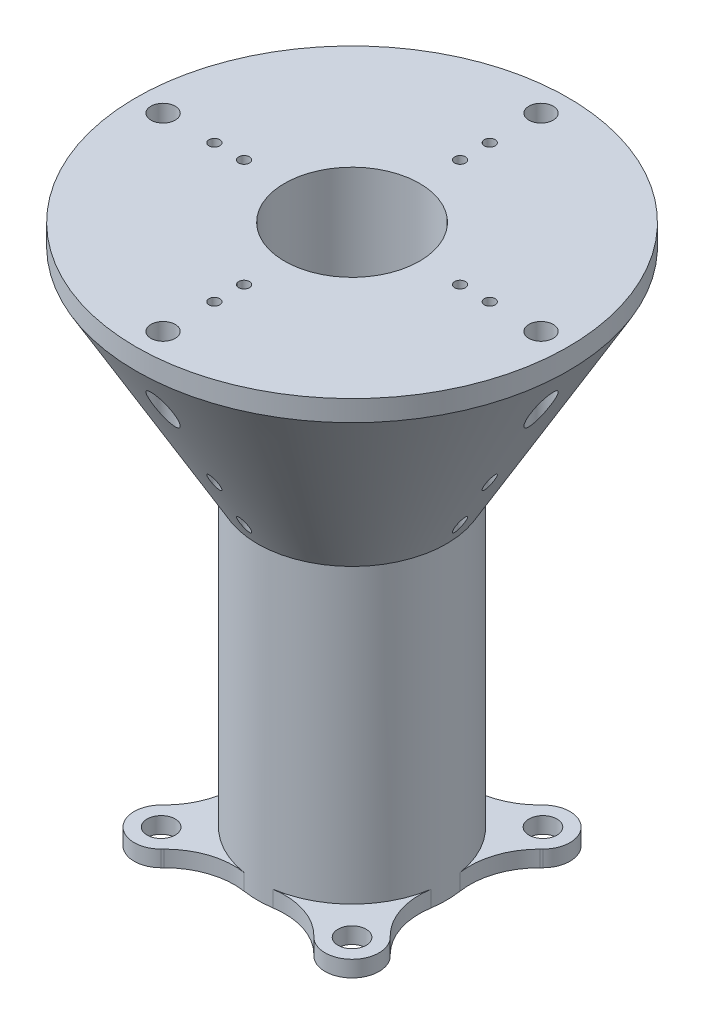
from build123d import *

# Parameters (mm, degrees)
SKETCH_1_R          = 17.5
SKETCH_1_R_2        = 12.5
EXTRUDE_1_DEPTH     = 100
SKETCH_2_R          = 2.6
EXTRUDE_1_2_DEPTH   = 3
EXTRUDE_START       = -3
SKETCH_3_R          = 40
SKETCH_3_R_2        = 2.25
SKETCH_3_R_3        = 17.5
EXTRUDE_2_DEPTH     = 3
CHAMFER_1_SIZE      = 39.837168574
CHAMFER_1_SIZE_2    = 23
FILLET_1_R          = 13
SKETCH_4_R          = 1
CUT_EXTRUDE_1_DEPTH = 115.891253


with BuildPart() as part:
    # 草图1 → Extrude 1 (new body)
    with BuildSketch(Plane(origin=(0, 0, 0), x_dir=(1, 0, 0), z_dir=(0, 1, 0))):
        Circle(SKETCH_1_R)
        Circle(SKETCH_1_R_2, mode=Mode.SUBTRACT)
    extrude(amount=EXTRUDE_1_DEPTH)

    # 草图2 → Extrude 1 2 (add)
    # profile 1 of 4: a face of its own
    with BuildSketch(Plane(origin=(0, 0, 0), x_dir=(1, 0, 0), z_dir=(0, 1, 0))):
        with BuildLine():
            Line((-21.213203436, 14.142135624), (-15.394075132, 8.32300732))
            ThreePointArc((-15.394075132, 8.32300732), (-12.374368671, 12.374368671), (-8.32300732, 15.394075132))
            Line((-8.32300732, 15.394075132), (-14.142135624, 21.213203436))
            ThreePointArc((-14.142135624, 21.213203436), (-21.213203436, 21.213203436), (-21.213203436, 14.142135624))
        make_face()
        with Locations(Location((-17.67766953, 17.67766953, 0), (0, 0, 270))):
            Circle(SKETCH_2_R, mode=Mode.SUBTRACT)
    # profile 2 of 4: a face of its own
    with BuildSketch(Plane(origin=(0, 0, 0), x_dir=(1, 0, 0), z_dir=(0, 1, 0))):
        with BuildLine():
            ThreePointArc((8.32300732, 15.394075132), (12.374368671, 12.374368671), (15.394075132, 8.32300732))
            Line((15.394075132, 8.32300732), (21.213203436, 14.142135624))
            ThreePointArc((21.213203436, 14.142135624), (21.213203436, 21.213203436), (14.142135624, 21.213203436))
            Line((14.142135624, 21.213203436), (8.32300732, 15.394075132))
        make_face()
        with Locations(Location((17.67766953, 17.67766953, 0), (0, 0, 270))):
            Circle(SKETCH_2_R, mode=Mode.SUBTRACT)
    # profile 3 of 4: a face of its own
    with BuildSketch(Plane(origin=(0, 0, 0), x_dir=(1, 0, 0), z_dir=(0, 1, 0))):
        with BuildLine():
            Line((-14.142135624, -21.213203436), (-8.32300732, -15.394075132))
            ThreePointArc((-8.32300732, -15.394075132), (-12.374368671, -12.374368671), (-15.394075132, -8.32300732))
            Line((-15.394075132, -8.32300732), (-21.213203436, -14.142135624))
            ThreePointArc((-21.213203436, -14.142135624), (-21.213203436, -21.213203436), (-14.142135624, -21.213203436))
        make_face()
        with Locations(Location((-17.67766953, -17.67766953, 0), (0, 0, 270))):
            Circle(SKETCH_2_R, mode=Mode.SUBTRACT)
    # profile 4 of 4: a face of its own
    with BuildSketch(Plane(origin=(0, 0, 0), x_dir=(1, 0, 0), z_dir=(0, 1, 0))):
        with BuildLine():
            Line((8.32300732, -15.394075132), (14.142135624, -21.213203436))
            ThreePointArc((14.142135624, -21.213203436), (21.213203436, -21.213203436), (21.213203436, -14.142135624))
            Line((21.213203436, -14.142135624), (15.394075132, -8.32300732))
            ThreePointArc((15.394075132, -8.32300732), (12.374368671, -12.374368671), (8.32300732, -15.394075132))
        make_face()
        with Locations(Location((17.67766953, -17.67766953, 0), (0, 0, 270))):
            Circle(SKETCH_2_R, mode=Mode.SUBTRACT)
    extrude(amount=EXTRUDE_1_2_DEPTH)

    # 草图3 → 凸台-拉伸2 (add)
    with BuildSketch(Plane(origin=(0, 100, 0), x_dir=(1, 0, 0), z_dir=(0, 1, 0)).offset(EXTRUDE_START)):
        with Locations(Location((0, 0, 0), (0, 0, 270))):
            Circle(SKETCH_3_R)
        with Locations(Location((-35, 0, 0), (0, 0, 270))):
            Circle(SKETCH_3_R_2, mode=Mode.SUBTRACT)
        with Locations(Location((0, -35, 0), (0, 0, 270))):
            Circle(SKETCH_3_R_2, mode=Mode.SUBTRACT)
        with Locations(Location((0, 0, 0), (0, 0, 118.398450401))):
            Circle(SKETCH_3_R_3, mode=Mode.SUBTRACT)
        with Locations(Location((35, 0, 0), (0, 0, 270))):
            Circle(SKETCH_3_R_2, mode=Mode.SUBTRACT)
        with Locations(Location((0, 35, 0), (0, 0, 270))):
            Circle(SKETCH_3_R_2, mode=Mode.SUBTRACT)
    extrude(amount=EXTRUDE_2_DEPTH)

    # 倒角1
    # the kernel refuses this chamfer: 39.837168574, 23 mm, written as the material it adds along each edge
    with BuildSketch(Plane(origin=(0, 97, 0), x_dir=(1, 0, 0), z_dir=(0, 0, -1))) as chamfer_1_piece_1_section:
        Polygon((17.5, CHAMFER_1_SIZE), (17.5 + CHAMFER_1_SIZE_2, 0), (17.5, 0), align=None)
    chamfer_1_piece_1 = revolve(axis=Axis((0, 97, 0), (0, -1, 0)), mode=Mode.PRIVATE)
    chamfer_1_piece_1 = chamfer_1_piece_1 & Plane(origin=(0, 76.173850832, 0), x_dir=(0, 0, 1), z_dir=(0, -1, 0)) * Cylinder(40, 162, mode=Mode.PRIVATE)
    chamfer_1_piece_1 = chamfer_1_piece_1 - Plane(origin=(-35, 76.173850832, 0), x_dir=(0, 0, 1), z_dir=(0, -1, 0)) * Cylinder(2.25, 162, mode=Mode.PRIVATE)
    chamfer_1_piece_1 = chamfer_1_piece_1 - Plane(origin=(0, 76.173850832, 35), x_dir=(0, 0, 1), z_dir=(0, -1, 0)) * Cylinder(2.25, 162, mode=Mode.PRIVATE)
    chamfer_1_piece_1 = chamfer_1_piece_1 - Plane(origin=(35, 76.173850832, 0), x_dir=(0, 0, 1), z_dir=(0, -1, 0)) * Cylinder(2.25, 162, mode=Mode.PRIVATE)
    chamfer_1_piece_1 = chamfer_1_piece_1 - Plane(origin=(0, 76.173850832, -35), x_dir=(0, 0, 1), z_dir=(0, -1, 0)) * Cylinder(2.25, 162, mode=Mode.PRIVATE)
    add(chamfer_1_piece_1)

    # 圆角1
    fillet_1_edges = [part.edges().sort_by_distance(p)[0] for p in [
        (-15.394075132, 1.5, -8.32300732),
        (-8.32300732, 1.5, -15.394075132),
        (8.32300732, 1.5, -15.394075132),
        (15.394075132, 1.5, -8.32300732),
        (-8.32300732, 1.5, 15.394075132),
        (-15.394075132, 1.5, 8.32300732),
        (15.394075132, 1.5, 8.32300732),
        (8.32300732, 1.5, 15.394075132),
    ]]
    fillet(fillet_1_edges, radius=FILLET_1_R)

    # 草图4 → 切除-拉伸1 (cut, through all)
    with BuildSketch(Plane(origin=(0, 100, 0), x_dir=(1, 0, 0), z_dir=(0, 1, 0))):
        with Locations(Location((0, 25.5, 0), (0, 0, 270))):
            Circle(SKETCH_4_R)
        with Locations(Location((0, 20, 0), (0, 0, 270))):
            Circle(SKETCH_4_R)
        with Locations(Location((25.5, 0, 0), (0, 0, 270))):
            Circle(SKETCH_4_R)
        with Locations(Location((20, 0, 0), (0, 0, 270))):
            Circle(SKETCH_4_R)
        with Locations(Location((0, -25.5, 0), (0, 0, 270))):
            Circle(SKETCH_4_R)
        with Locations(Location((0, -20, 0), (0, 0, 270))):
            Circle(SKETCH_4_R)
        with Locations(Location((-25.5, 0, 0), (0, 0, 270))):
            Circle(SKETCH_4_R)
        with Locations(Location((-20, 0, 0), (0, 0, 270))):
            Circle(SKETCH_4_R)
    extrude(amount=-CUT_EXTRUDE_1_DEPTH, mode=Mode.SUBTRACT)


solid = part.part
